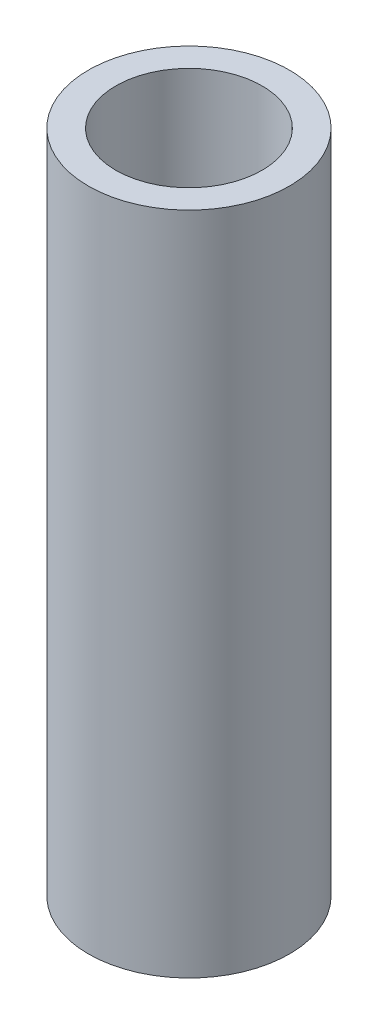
from build123d import *

# Parameters (mm, degrees)
SKETCH1_R           = 33.401
SKETCH1_R_2         = 24.3078
BOSS_EXTRUDE1_DEPTH = 110.49


with BuildPart() as part:
    # Sketch1 → Boss-Extrude1 (new, symmetric)
    with BuildSketch(Plane(origin=(0, 0, 0), x_dir=(1, 0, 0), z_dir=(0, 1, 0))):
        Circle(SKETCH1_R)
        Circle(SKETCH1_R_2, mode=Mode.SUBTRACT)
    extrude(amount=BOSS_EXTRUDE1_DEPTH, both=True)


solid = part.part
